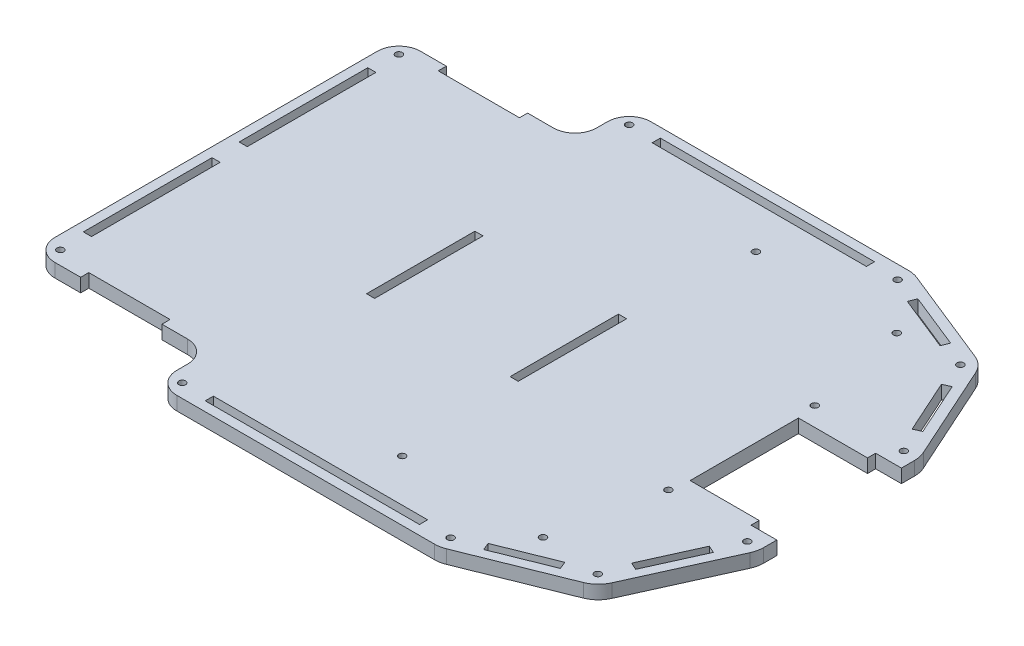
from build123d import *

# Parameters (mm, degrees)
ESTRUSIONE_ESTRUSIONE1_DEPTH  = 5
FORO_FILETTATO_M3X0_5_1_D     = 2.5
FORO_FILETTATO_M3X0_5_1_DEPTH = 7.5
FORO_FILETTATO_M3X0_5_1_TIP   = 0.751075774
SCHIZZO26_W                   = 30
SCHIZZO26_H                   = 3
TAGLIO_ESTRUSIONE12_DEPTH     = 10
SCHIZZO4_W                    = 79.084596206
SCHIZZO4_H                    = 3
TAGLIO_ESTRUSIONE2_DEPTH      = 10
SCHIZZO7_W                    = 3
SCHIZZO7_H                    = 47.5
TAGLIO_ESTRUSIONE5_DEPTH      = 10
SCHIZZO12_W                   = 3
SCHIZZO12_H                   = 40
TAGLIO_ESTRUSIONE8_DEPTH      = 247.132586221
TAGLIO_ESTRUSIONE1_DEPTH      = 247.132586221
TAGLIO_ESTRUSIONE1_DEPTH_BACK = 247.132586221
SCHIZZO33_W                   = 9.5
SCHIZZO33_H                   = 3
TAGLIO_ESTRUSIONE14_DEPTH     = 247.132586221
FORO_FILETTATO_M3X0_5_4_D     = 2.5
FORO_FILETTATO_M3X0_5_5_D     = 2.5
RACCORDO1_R                   = 8
RACCORDO2_R                   = 10


with BuildPart() as part:
    # Schizzo1 → Estrusione-Estrusione1 (new body)
    with BuildSketch(Plane(origin=(0, 0, 0), x_dir=(1, 0, 0), z_dir=(0, 1, 0))):
        Polygon((65, 67.5), (65, 87.5), (170.052105959, 87.5), (211.585225273, 70.801270189), (230, 30), (230, -30), (211.585225273, -70.801270189), (170.052105959, -87.5), (65, -87.5), (65, -67.5), (0, -67.5), (0, 67.5), align=None)
    extrude(amount=ESTRUSIONE_ESTRUSIONE1_DEPTH)

    # Foro filettato M3x0.5-1
    with Locations(Plane(origin=(0, 5, 0), x_dir=(1, 0, 0), z_dir=(0, 1, 0))):
        with Locations((207.854862265, 66.912097904), (225, 28.92393853), (225, -28.92393853), (207.854862265, -66.912097904), (169.084596206, -82.5), (169.084596206, 82.5), (70, 82.5), (70, -82.5), (5, -62.5), (5, 62.5)):
            Hole(FORO_FILETTATO_M3X0_5_1_D / 2, depth=FORO_FILETTATO_M3X0_5_1_DEPTH)
            with Locations((0, 0, -(FORO_FILETTATO_M3X0_5_1_DEPTH + FORO_FILETTATO_M3X0_5_1_TIP / 2))):  # 118° drill point
                Cone(0, FORO_FILETTATO_M3X0_5_1_D / 2, FORO_FILETTATO_M3X0_5_1_TIP, mode=Mode.SUBTRACT)

    # Schizzo26 → Taglio-Estrusione12 (cut)
    with BuildSketch(Plane(origin=(0, 5, 0), x_dir=(1, 0, 0), z_dir=(0, 1, 0))):
        with Locations((32.5, -66)):
            Rectangle(SCHIZZO26_W, SCHIZZO26_H)
    taglio_estrusione12 = extrude(amount=-TAGLIO_ESTRUSIONE12_DEPTH, mode=Mode.SUBTRACT)

    # Specchia1: Taglio-Estrusione12 across plane
    add(taglio_estrusione12.mirror(Plane.XY), mode=Mode.SUBTRACT)

    # Schizzo4 → Taglio-Estrusione2 (cut)
    with BuildSketch(Plane(origin=(0, 5, 0), x_dir=(1, 0, 0), z_dir=(0, 1, 0))):
        with Locations((119.542298103, -82.5)):
            Rectangle(SCHIZZO4_W, SCHIZZO4_H)
        Polygon((219.519084515, 37.421559693), (210.601374282, 57.180362615), (213.33577775, 58.414476741), (222.253487983, 38.655673819), align=None)
        with Locations((119.542298103, 82.5)):
            Rectangle(SCHIZZO4_W, SCHIZZO4_H)
        Polygon((199.136249234, 72.034186035), (178.92231814, 80.161362114), (177.803209237, 77.377911869), (198.017140331, 69.250735791), align=None)
        Polygon((177.803209237, -77.377911869), (198.017140331, -69.250735791), (199.136249234, -72.034186035), (178.92231814, -80.161362114), align=None)
        Polygon((210.601374282, -57.180362615), (219.519084515, -37.421559693), (222.253487983, -38.655673819), (213.33577775, -58.414476741), align=None)
    extrude(amount=-TAGLIO_ESTRUSIONE2_DEPTH, mode=Mode.SUBTRACT)

    # Schizzo7 → Taglio-Estrusione5 (cut)
    with BuildSketch(Plane(origin=(0, 5, 0), x_dir=(1, 0, 0), z_dir=(0, 1, 0))):
        with Locations((5, 28.75)):
            Rectangle(SCHIZZO7_W, SCHIZZO7_H)
        with Locations((5, -28.75)):
            Rectangle(SCHIZZO7_W, SCHIZZO7_H)
    extrude(amount=-TAGLIO_ESTRUSIONE5_DEPTH, mode=Mode.SUBTRACT)

    # Schizzo12 → Taglio-Estrusione8 (cut, through all)
    with BuildSketch(Plane(origin=(0, 5, 0), x_dir=(1, 0, 0), z_dir=(0, 1, 0))):
        with Locations((77.042298103, 0)):
            Rectangle(SCHIZZO12_W, SCHIZZO12_H)
        with Locations((130.042298103, 0)):
            Rectangle(SCHIZZO12_W, SCHIZZO12_H)
    extrude(amount=-TAGLIO_ESTRUSIONE8_DEPTH, mode=Mode.SUBTRACT)

    # Schizzo2 → Taglio-Estrusione1 (cut, two sides: drawn at the far end of the back side and taken through both)
    with BuildSketch(Plane(origin=(0, 5, 0), x_dir=(1, 0, 0), z_dir=(0, 1, 0)).offset(-TAGLIO_ESTRUSIONE1_DEPTH_BACK)):
        Polygon((747.76470929, 20), (230, 20), (195, 20), (195, -20), (230, -20), (747.76470929, -20), (1783.294127869, -20), (1783.294127869, 20), align=None)
    extrude(amount=TAGLIO_ESTRUSIONE1_DEPTH + TAGLIO_ESTRUSIONE1_DEPTH_BACK, mode=Mode.SUBTRACT)

    # Schizzo33 → Taglio-Estrusione14 (cut, through all)
    with BuildSketch(Plane(origin=(0, 5, 0), x_dir=(1, 0, 0), z_dir=(0, 1, 0))):
        with Locations((225.25, 21.5)):
            Rectangle(SCHIZZO33_W, SCHIZZO33_H)
    taglio_estrusione14 = extrude(amount=-TAGLIO_ESTRUSIONE14_DEPTH, mode=Mode.SUBTRACT)

    # Specchia3: Taglio-Estrusione14 across plane
    add(taglio_estrusione14.mirror(Plane.XY), mode=Mode.SUBTRACT)

    # Foro filettato M3x0.5-4 (through all)
    with Locations(Plane(origin=(0, 5, 0), x_dir=(1, 0, 0), z_dir=(0, 1, 0))):
        with Locations((194, 27), (194, -27)):
            Hole(FORO_FILETTATO_M3X0_5_4_D / 2)

    # Foro filettato M3x0.5-5 (through all)
    with Locations(Plane(origin=(0, 5, 0), x_dir=(1, 0, 0), z_dir=(0, 1, 0))):
        with Locations((133.986816105, 65.3), (185.986816105, 65.3), (185.986816105, -65.3), (133.986816105, -65.3)):
            Hole(FORO_FILETTATO_M3X0_5_5_D / 2)

    # Raccordo1
    raccordo1_edges = [part.edges().sort_by_distance(p)[0] for p in [
        (0, 2.5, 67.5),
        (0, 2.5, -67.5),
        (65, 2.5, -87.5),
        (65, 2.5, 87.5),
        (65, 2.5, 67.5),
        (65, 2.5, -67.5),
    ]]
    fillet(raccordo1_edges, radius=RACCORDO1_R)

    # Raccordo2
    raccordo2_edges = [part.edges().sort_by_distance(p)[0] for p in [
        (170.052105959, 2.5, -87.5),
        (211.585225273, 2.5, -70.801270189),
        (230, 2.5, -30),
        (230, 2.5, 30),
        (211.585225273, 2.5, 70.801270189),
        (170.052105959, 2.5, 87.5),
    ]]
    fillet(raccordo2_edges, radius=RACCORDO2_R)


solid = part.part
